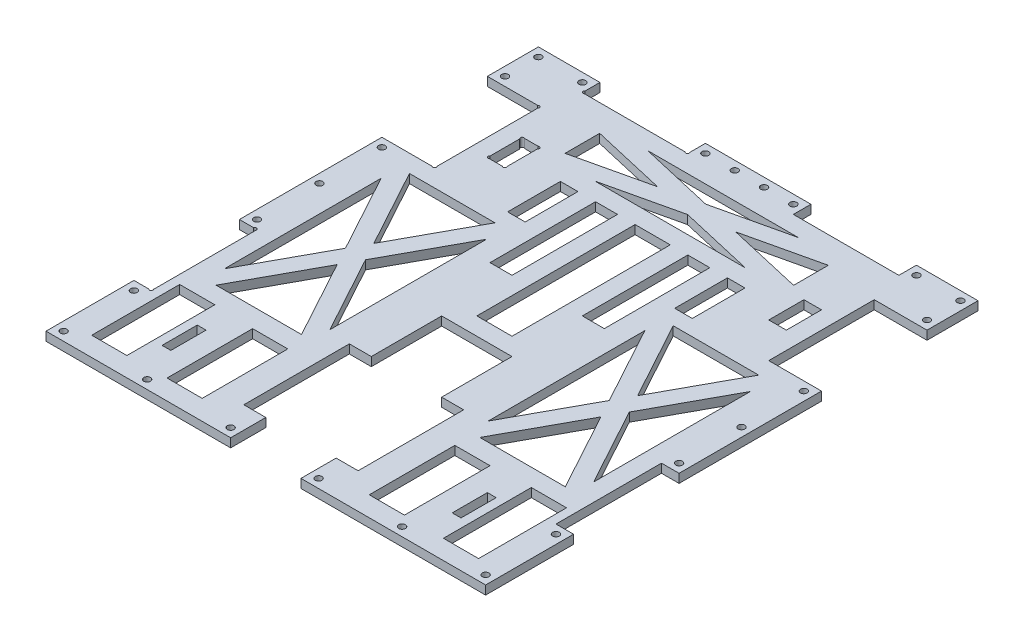
from build123d import *

# Parameters (mm, degrees)
SKETCH1_W           = 317.5
SKETCH1_H           = 355.6
BOSS_EXTRUDE1_DEPTH = 6.35
SKETCH2_W           = 50.8
SKETCH2_H           = 152.4
CUT_EXTRUDE1_DEPTH  = 239.442288615
SKETCH3_W           = 25.4
SKETCH3_H           = 76.2
SKETCH3_W_2         = 12.7
SKETCH3_H_2         = 25.4
CUT_EXTRUDE2_DEPTH  = 239.442288615
SKETCH4_W           = 12.7
SKETCH4_H           = 76.2
SKETCH4_W_2         = 76.2
SKETCH4_H_2         = 12.7
SKETCH4_W_3         = 15.875
CUT_EXTRUDE3_DEPTH  = 239.442288615
SKETCH5_W           = 25.4
SKETCH5_H           = 61.819423232
SKETCH5_H_2         = 114.3
SKETCH5_W_2         = 12.7
SKETCH5_H_3         = 38.1
SKETCH5_H_4         = 63.5
SKETCH5_W_3         = 6.35
SKETCH5_H_5         = 25.4
CUT_EXTRUDE4_DEPTH  = 239.442288615
SKETCH7_R           = 2.413
CUT_EXTRUDE6_DEPTH  = 239.442288615
SKETCH8_R           = 1.27
CUT_EXTRUDE7_DEPTH  = 239.442288615


with BuildPart() as part:
    # Sketch1 → Boss-Extrude1 (new body)
    with BuildSketch(Plane(origin=(0, 0, 0), x_dir=(1, 0, 0), z_dir=(0, 1, 0))):
        Rectangle(SKETCH1_W, SKETCH1_H)
    extrude(amount=BOSS_EXTRUDE1_DEPTH)

    # Sketch2 → Cut-Extrude1 (cut, through all)
    with BuildSketch(Plane(origin=(0, 6.35, 0), x_dir=(1, 0, 0), z_dir=(0, 1, 0))):
        with Locations((0, -101.6)):
            Rectangle(SKETCH2_W, SKETCH2_H)
    extrude(amount=-CUT_EXTRUDE1_DEPTH, mode=Mode.SUBTRACT)

    # Sketch3 → Cut-Extrude2 (cut, through all)
    with BuildSketch(Plane(origin=(0, 6.35, 0), x_dir=(1, 0, 0), z_dir=(0, 1, 0))):
        with Locations((133.35, 102.87)):
            Rectangle(SKETCH3_W, SKETCH3_H)
        with Locations((101.6, 102.87)):
            Rectangle(SKETCH3_W_2, SKETCH3_H_2)
        with Locations((-101.6, 102.87)):
            Rectangle(SKETCH3_W_2, SKETCH3_H_2)
        with Locations((-133.35, 102.87)):
            Rectangle(SKETCH3_W, SKETCH3_H)
    extrude(amount=-CUT_EXTRUDE2_DEPTH, mode=Mode.SUBTRACT)

    # Sketch4 → Cut-Extrude3 (cut, through all)
    with BuildSketch(Plane(origin=(0, 6.35, 0), x_dir=(1, 0, 0), z_dir=(0, 1, 0))):
        with Locations((-152.4, 102.87)):
            Rectangle(SKETCH4_W, SKETCH4_H)
        with Locations((-152.4, -76.2)):
            Rectangle(SKETCH4_W, SKETCH4_H)
        with Locations((152.4, 102.87)):
            Rectangle(SKETCH4_W, SKETCH4_H)
        with Locations((152.4, -76.2)):
            Rectangle(SKETCH4_W, SKETCH4_H)
        with Locations((76.2, 171.45)):
            Rectangle(SKETCH4_W_2, SKETCH4_H_2)
        with Locations((-76.2, 171.45)):
            Rectangle(SKETCH4_W_2, SKETCH4_H_2)
        with Locations((-33.3375, -114.3)):
            Rectangle(SKETCH4_W_3, SKETCH4_H)
        with Locations((33.3375, 63.5)):
            Rectangle(SKETCH4_W_3, SKETCH4_H)
        with Locations((-33.3375, 63.5)):
            Rectangle(SKETCH4_W_3, SKETCH4_H)
        with Locations((33.3375, -114.3)):
            Rectangle(SKETCH4_W_3, SKETCH4_H)
    extrude(amount=-CUT_EXTRUDE3_DEPTH, mode=Mode.SUBTRACT)

    # Sketch5 → Cut-Extrude4 (cut, through all)
    with BuildSketch(Plane(origin=(0, 6.35, 0), x_dir=(1, 0, 0), z_dir=(0, 1, 0))):
        with Locations((-73.025, -132.509711616)):
            Rectangle(SKETCH5_W, SKETCH5_H)
        Polygon((-95.25, -31.040878658), (-126.116793459, -87.63), (-64.383206541, -87.63), align=None)
        Polygon((-133.35, 38.809121342), (-133.35, -74.369121342), (-102.483206541, -17.78), align=None)
        Polygon((-57.15, 38.809121342), (-88.016793459, -17.78), (-57.15, -74.369121342), align=None)
        Polygon((-126.116793459, 52.07), (-95.25, -4.519121342), (-64.383206541, 52.07), align=None)
        Polygon((0, 126.833110246), (-54.310144398, 114.3), (54.310144398, 114.3), align=None)
        Polygon((-82.55, 145.883110246), (-82.55, 120.816889754), (-28.239855602, 133.35), align=None)
        Polygon((82.55, 145.883110246), (28.239855602, 133.35), (82.55, 120.816889754), align=None)
        Polygon((-54.310144398, 152.4), (0, 139.866889754), (54.310144398, 152.4), align=None)
        with Locations((0, 44.45)):
            Rectangle(SKETCH5_W, SKETCH5_H_2)
        with Locations((-60.325, 82.55)):
            Rectangle(SKETCH5_W_2, SKETCH5_H_3)
        with Locations((60.325, 82.55)):
            Rectangle(SKETCH5_W_2, SKETCH5_H_3)
        with Locations((-127, -132.08)):
            Rectangle(SKETCH5_W, SKETCH5_H_4)
        with Locations((-104.775, -132.08)):
            Rectangle(SKETCH5_W_3, SKETCH5_H_5)
    cut_extrude4 = extrude(amount=-CUT_EXTRUDE4_DEPTH, mode=Mode.SUBTRACT)

    # Mirror1: Cut-Extrude4 across plane
    add(cut_extrude4.mirror(Plane(origin=(0, 0, 0), x_dir=(0, 0, 1), z_dir=(1, 0, 0))), mode=Mode.SUBTRACT)

    # Sketch7 → Cut-Extrude6 (cut, through all)
    with BuildSketch(Plane(origin=(0, 6.35, 0), x_dir=(1, 0, 0), z_dir=(0, 1, 0))):
        with Locations((-152.4, -171.45)):
            Circle(SKETCH7_R)
        with Locations((-152.4, 171.45)):
            Circle(SKETCH7_R)
        with Locations((-120.65, 171.45)):
            Circle(SKETCH7_R)
        with Locations((-152.4, 147.32)):
            Circle(SKETCH7_R)
        with Locations((-31.75, 171.45)):
            Circle(SKETCH7_R)
        with Locations((-10.583333333, 171.45)):
            Circle(SKETCH7_R)
        with Locations((10.583333333, 171.45)):
            Circle(SKETCH7_R)
        with Locations((31.75, 171.45)):
            Circle(SKETCH7_R)
        with Locations((-31.75, -171.45)):
            Circle(SKETCH7_R)
        with Locations((-92.075, -171.45)):
            Circle(SKETCH7_R)
        with Locations((-152.4, -120.65)):
            Circle(SKETCH7_R)
        with Locations((-152.4, -31.75)):
            Circle(SKETCH7_R)
        with Locations((-152.4, 58.42)):
            Circle(SKETCH7_R)
        with Locations((-152.4, 13.335)):
            Circle(SKETCH7_R)
        with Locations((31.75, -171.45)):
            Circle(SKETCH7_R)
        with Locations((152.4, 13.335)):
            Circle(SKETCH7_R)
        with Locations((152.4, 58.42)):
            Circle(SKETCH7_R)
        with Locations((152.4, -31.75)):
            Circle(SKETCH7_R)
        with Locations((152.4, -120.65)):
            Circle(SKETCH7_R)
        with Locations((92.075, -171.45)):
            Circle(SKETCH7_R)
        with Locations((152.4, 147.32)):
            Circle(SKETCH7_R)
        with Locations((120.65, 171.45)):
            Circle(SKETCH7_R)
        with Locations((152.4, 171.45)):
            Circle(SKETCH7_R)
        with Locations((152.4, -171.45)):
            Circle(SKETCH7_R)
    extrude(amount=-CUT_EXTRUDE6_DEPTH, mode=Mode.SUBTRACT)

    # Sketch8 → Cut-Extrude7 (cut, through all)
    with BuildSketch(Plane(origin=(0, 6.35, 0), x_dir=(1, 0, 0), z_dir=(0, 1, 0))):
        with Locations((-39.09938383, 165.88366572)):
            Circle(SKETCH8_R)
        with Locations((-113.539841326, 166.117378391)):
            Circle(SKETCH8_R)
        with Locations((-121.560019166, 140.084130304)):
            Circle(SKETCH8_R)
        with Locations((-121.565556473, 65.650145639)):
            Circle(SKETCH8_R)
        with Locations((-147.253032713, -38.506954901)):
            Circle(SKETCH8_R)
        with Locations((-147.044413998, -113.510037468)):
            Circle(SKETCH8_R)
        with Locations((-107.194291917, 114.549311364)):
            Circle(SKETCH8_R)
        with Locations((-96.034081321, 114.570942203)):
            Circle(SKETCH8_R)
        with Locations((-107.184450657, 91.18332828)):
            Circle(SKETCH8_R)
        with Locations((-96.208355861, 91.003339093)):
            Circle(SKETCH8_R)
    extrude(amount=-CUT_EXTRUDE7_DEPTH, mode=Mode.SUBTRACT)


solid = part.part
